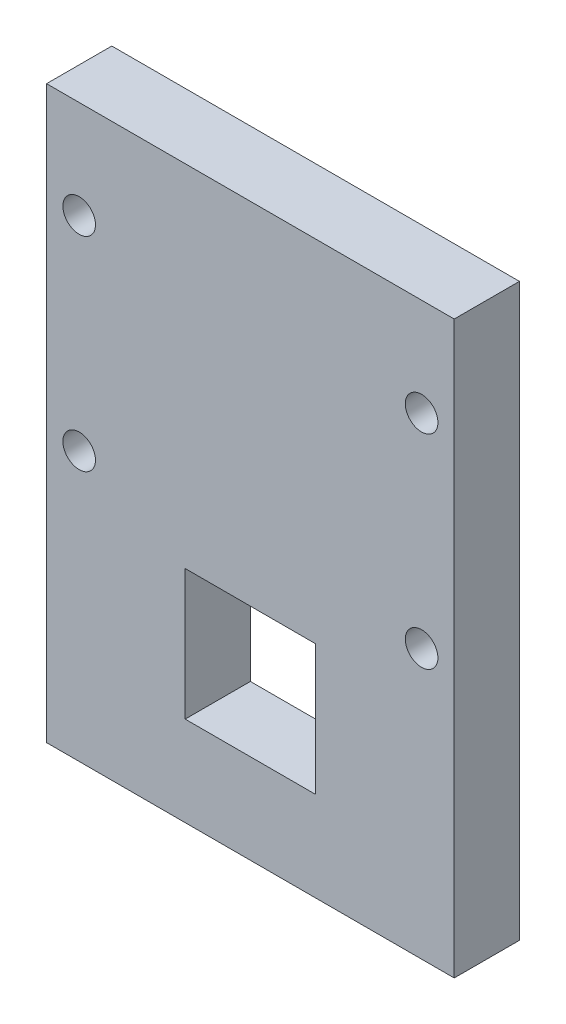
from build123d import *

# Parameters (mm, degrees)
SKETCH1_W           = 25
SKETCH1_H           = 35
SKETCH1_R           = 1
SKETCH1_W_2         = 8
SKETCH1_H_2         = 8
BOSS_EXTRUDE1_DEPTH = 4


with BuildPart() as part:
    # Sketch1 → Boss-Extrude1 (new body)
    with BuildSketch(Plane.XY):
        with Locations((-12.5, 17.5)):
            Rectangle(SKETCH1_W, SKETCH1_H)
        with Locations((-23, 16.5)):
            Circle(SKETCH1_R, mode=Mode.SUBTRACT)
        with Locations((-12.5, 9.5)):
            Rectangle(SKETCH1_W_2, SKETCH1_H_2, mode=Mode.SUBTRACT)
        with Locations((-2, 16.5)):
            Circle(SKETCH1_R, mode=Mode.SUBTRACT)
        with Locations((-23, 29)):
            Circle(SKETCH1_R, mode=Mode.SUBTRACT)
        with Locations((-2, 29)):
            Circle(SKETCH1_R, mode=Mode.SUBTRACT)
    extrude(amount=BOSS_EXTRUDE1_DEPTH)


solid = part.part
